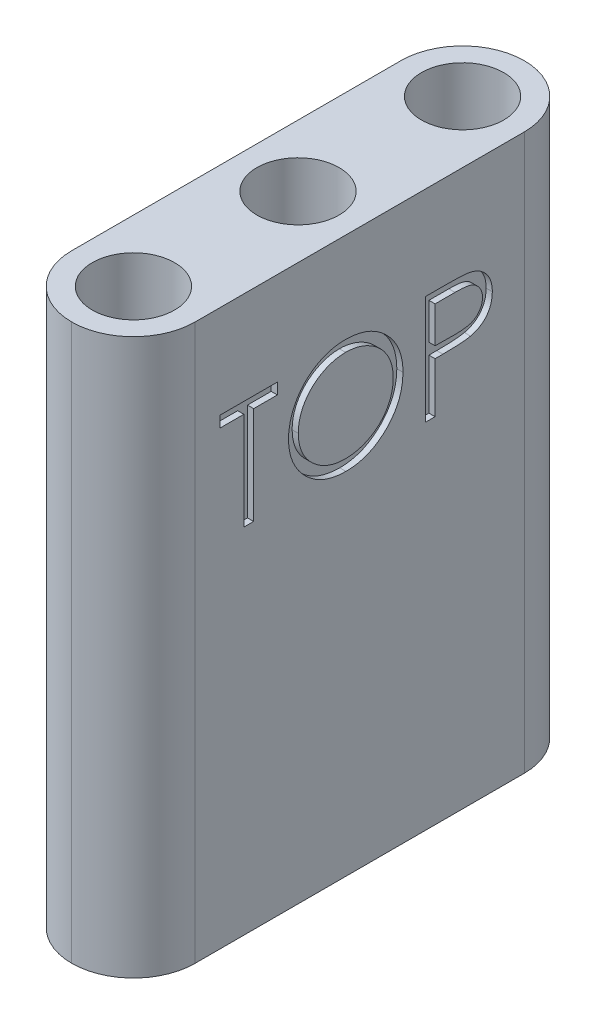
from build123d import *

# Parameters (mm, degrees)
SKETCH1_W           = 6
SKETCH1_H           = 22
SKETCH1_R           = 2
BOSS_EXTRUDE1_DEPTH = 27
FILLET1_R           = 3
CUT_EXTRUDE1_DEPTH  = 0.3


with BuildPart() as part:
    # Sketch1 → Boss-Extrude1 (new body)
    with BuildSketch(Plane(origin=(0, 0, 0), x_dir=(1, 0, 0), z_dir=(0, 1, 0))):
        with Locations((3, -11)):
            Rectangle(SKETCH1_W, SKETCH1_H)
        with Locations(Location((3, -11, 0), (0, 0, 270))):
            Circle(SKETCH1_R, mode=Mode.SUBTRACT)
        with Locations(Location((3, -19, 0), (0, 0, 270))):
            Circle(SKETCH1_R, mode=Mode.SUBTRACT)
        with Locations(Location((3, -3, 0), (0, 0, 90))):
            Circle(SKETCH1_R, mode=Mode.SUBTRACT)
    extrude(amount=BOSS_EXTRUDE1_DEPTH)

    # Fillet1
    fillet1_edges = [part.edges().sort_by_distance(p)[0] for p in [
        (0, 13.5, 0),
        (6, 13.5, 0),
        (0, 13.5, 22),
        (6, 13.5, 22),
    ]]
    fillet(fillet1_edges, radius=FILLET1_R - 0.0001)  # a hair under: the kernel refuses the full size

    # Sketch2 → Cut-Extrude1 (cut)
    # profile 1 of 3: a face of its own
    with BuildSketch(Plane(origin=(6, 0, 0), x_dir=(0, 0, -1), z_dir=(1, 0, 0))):
        Polygon((-17.784188034, 21.929487179), (-17.784188034, 22.472222222), (-15.00267094, 22.472222222), (-15.00267094, 21.929487179), (-16.155982906, 21.929487179), (-16.155982906, 17.180555556), (-16.630876068, 17.180555556), (-16.630876068, 21.929487179), align=None)
    # profile 2 of 3: a face of its own
    with BuildSketch(Plane(origin=(6, 0, 0), x_dir=(0, 0, -1), z_dir=(1, 0, 0))):
        with BuildLine():
            add(Edge.make_bspline(
                [(-11.712339744, 22.607905983), (-11.61435606, 22.605424222), (-11.42190802, 22.60054984), (-11.139068592, 22.563237386), (-10.869049817, 22.498686023), (-10.609652107, 22.412714609), (-10.363978202, 22.298030002), (-10.130178924, 22.15941079), (-9.908810555, 21.995404715), (-9.7028568, 21.807279575), (-9.514387363, 21.602592686), (-9.348341082, 21.384155846), (-9.2091819, 21.153289799), (-9.094903389, 20.910688305), (-9.005249538, 20.65690002), (-8.943383841, 20.390571945), (-8.903865448, 20.113429687), (-8.899245403, 19.924400975), (-8.896901709, 19.828508948)],
                knots=[0, 0, 0, 0, 1.065120563, 2.091984664, 3.0946048, 4.079830382, 5.057816894, 6.036188127, 7.030412546, 8.04752943, 9.064399622, 10.05169764, 11.02544977, 11.989514704, 12.962713494, 13.945757189, 14.957906945, 16, 16, 16, 16], degree=3))
            add(Edge.make_bspline(
                [(-8.896901709, 19.828508948), (-8.89924506, 19.733323285), (-8.903864075, 19.545701316), (-8.943428774, 19.270317775), (-9.005478857, 19.005597317), (-9.094070831, 18.751981866), (-9.20780459, 18.509203883), (-9.347890385, 18.277902179), (-9.512901501, 18.058000925), (-9.700690431, 17.851909158), (-9.905403911, 17.662924886), (-10.124978243, 17.49824992), (-10.354475286, 17.356547969), (-10.596848297, 17.243482177), (-10.848882877, 17.153112725), (-11.112834722, 17.09149863), (-11.387467012, 17.051755124), (-11.574748173, 17.047191415), (-11.669938568, 17.044871795)],
                knots=[0, 0, 0, 0, 1.043624062, 2.057103931, 3.04512605, 4.022047818, 4.998200453, 5.980619268, 6.982898556, 8.009068085, 9.034988726, 10.034168286, 11.015286542, 11.987931943, 12.962482838, 13.94673481, 14.956375938, 16, 16, 16, 16], degree=3))
            add(Edge.make_bspline(
                [(-11.669938568, 17.044871795), (-11.765830098, 17.04721432), (-11.95485783, 17.051832061), (-12.232348347, 17.091415852), (-12.498863508, 17.153315204), (-12.753641158, 17.241775899), (-12.996823373, 17.356101951), (-13.22888576, 17.49550619), (-13.448896851, 17.660919368), (-13.655032587, 17.848647403), (-13.843641494, 18.053013917), (-14.008075312, 18.271989517), (-14.1475109, 18.501278124), (-14.261453081, 18.741516047), (-14.351660061, 18.991541919), (-14.41320187, 19.253023545), (-14.453019321, 19.524470179), (-14.45760772, 19.709289799), (-14.459935897, 19.803068243)],
                knots=[0, 0, 0, 0, 1.053102029, 2.075944431, 3.073151272, 4.055350789, 5.033113405, 6.020478099, 7.024410459, 8.052272461, 9.079885166, 10.07527673, 11.055994387, 12.023226415, 12.992069828, 13.970394897, 14.97016774, 16, 16, 16, 16], degree=3))
            add(Edge.make_bspline(
                [(-14.459935897, 19.803068243), (-14.459127579, 19.866012873), (-14.457521141, 19.99110806), (-14.43818132, 20.176870658), (-14.410117796, 20.359645819), (-14.369898237, 20.5389138), (-14.31729655, 20.714235765), (-14.255229795, 20.886820847), (-14.179423124, 21.054920048), (-14.093727382, 21.2193297), (-13.998081553, 21.377486891), (-13.892436075, 21.526983403), (-13.780501649, 21.66907372), (-13.657790327, 21.800075738), (-13.528346416, 21.923800432), (-13.390070059, 22.038346445), (-13.243804999, 22.144746669), (-13.088921877, 22.240632184), (-12.929237104, 22.327353733), (-12.764625786, 22.401772484), (-12.597323588, 22.465644505), (-12.426546918, 22.517413372), (-12.252749275, 22.558283236), (-12.075551338, 22.586113402), (-11.895094277, 22.605502549), (-11.773520021, 22.607101391), (-11.712339744, 22.607905983)],
                knots=[0, 0, 0, 0, 1.037015668, 2.060948919, 3.074880161, 4.083647147, 5.086022904, 6.090072063, 7.104153813, 8.122640571, 9.144368836, 10.147691507, 11.138137339, 12.123020368, 13.103399296, 14.087645067, 15.080126199, 16.082011238, 17.087798457, 18.072939717, 19.057185487, 20.037253025, 21.01195951, 21.997135196, 22.992090687, 24, 24, 24, 24], degree=3))
        make_face()
        with BuildLine():
            add(Edge.make_bspline(
                [(-11.689019097, 22.06517094), (-11.73923646, 22.064558785), (-11.839191104, 22.063340326), (-11.987787962, 22.047290375), (-12.134430529, 22.024415424), (-12.279149088, 21.99178622), (-12.421338121, 21.947330092), (-12.562323, 21.896165862), (-12.700818093, 21.833843499), (-12.836366188, 21.763430005), (-12.967773504, 21.685492947), (-13.091768898, 21.599357061), (-13.208673371, 21.507042342), (-13.318200691, 21.40833335), (-13.420029249, 21.302727404), (-13.516163262, 21.191825507), (-13.602749415, 21.072457767), (-13.682102609, 20.94786108), (-13.75311351, 20.818197737), (-13.816258749, 20.684832826), (-13.867911476, 20.546678466), (-13.910036736, 20.40523349), (-13.94496145, 20.260721914), (-13.967086549, 20.112047476), (-13.983312855, 19.959957247), (-13.984461669, 19.857175158), (-13.985042735, 19.805188301)],
                knots=[0, 0, 0, 0, 1.008559885, 2.007477868, 2.99961109, 3.989939068, 4.984837346, 5.991145699, 7.001802488, 8.033829008, 9.059044045, 10.069351652, 11.065060232, 12.050310815, 13.029377138, 14.011219647, 14.996725999, 15.989392538, 16.977580475, 17.965360261, 18.951710183, 19.937753436, 20.929683414, 21.935841486, 22.955955122, 24, 24, 24, 24], degree=3))
            add(Edge.make_bspline(
                [(-13.985042735, 19.805188301), (-13.983115265, 19.728743039), (-13.979323336, 19.578351559), (-13.946125581, 19.357964008), (-13.894989977, 19.146163861), (-13.819610387, 18.944110021), (-13.725342196, 18.750065689), (-13.608884873, 18.565752245), (-13.470909827, 18.391119876), (-13.314180448, 18.227387743), (-13.142847308, 18.077942301), (-12.960915681, 17.94676429), (-12.770334631, 17.835774984), (-12.57060717, 17.74535541), (-12.362799581, 17.67370664), (-12.145572808, 17.624602043), (-11.920373899, 17.59228439), (-11.766869218, 17.589180818), (-11.689019097, 17.587606838)],
                knots=[0, 0, 0, 0, 1.032063989, 2.030389145, 3.003944642, 3.970395727, 4.937377036, 5.913328081, 6.909231446, 7.93887556, 8.970685674, 9.976071282, 10.964166581, 11.944589148, 12.933237628, 13.927779006, 14.949070134, 16, 16, 16, 16], degree=3))
            add(Edge.make_bspline(
                [(-11.689019097, 17.587606838), (-11.636692827, 17.588325755), (-11.532914117, 17.589751584), (-11.378555411, 17.604112679), (-11.226977567, 17.627141815), (-11.078393191, 17.660298877), (-10.932970917, 17.701796439), (-10.790103774, 17.751096218), (-10.651313502, 17.812602324), (-10.514849223, 17.880559346), (-10.384226334, 17.958029584), (-10.259531184, 18.041242025), (-10.143906786, 18.133420773), (-10.034461404, 18.23066318), (-9.932214779, 18.33492995), (-9.837858339, 18.446085523), (-9.751709806, 18.564831517), (-9.672386745, 18.689239214), (-9.601624669, 18.819257358), (-9.539970555, 18.953105799), (-9.487664522, 19.090454953), (-9.445439283, 19.231502924), (-9.412350549, 19.375981826), (-9.389551147, 19.524085111), (-9.373602912, 19.675516498), (-9.372400831, 19.777938756), (-9.371794872, 19.829568977)],
                knots=[0, 0, 0, 0, 1.047197238, 2.076906641, 3.100256066, 4.114471768, 5.12198147, 6.126382909, 7.136867548, 8.15857795, 9.17633901, 10.174870724, 11.156907918, 12.133735059, 13.104061851, 14.077631395, 15.04955518, 16.038496417, 17.029181396, 18.010275684, 18.986308667, 19.968651475, 20.955262928, 21.950658345, 22.966943676, 24, 24, 24, 24], degree=3))
            add(Edge.make_bspline(
                [(-9.371794872, 19.829568977), (-9.372401316, 19.880845989), (-9.373604311, 19.982563389), (-9.389543529, 20.132938674), (-9.412374637, 20.279976268), (-9.445277779, 20.423098922), (-9.48768694, 20.562343121), (-9.539979689, 20.697578084), (-9.601643178, 20.829307618), (-9.672412755, 20.957206138), (-9.751962869, 21.079934611), (-9.838888689, 21.197262068), (-9.934691061, 21.306985141), (-10.036632789, 21.411812595), (-10.147260199, 21.50950869), (-10.266072167, 21.600105835), (-10.391626299, 21.685790428), (-10.524563905, 21.763087408), (-10.661760121, 21.834470831), (-10.802539557, 21.895628896), (-10.945307363, 21.947596267), (-11.089700485, 21.991920726), (-11.236934274, 22.024287628), (-11.386013872, 22.04731099), (-11.536733025, 22.06333474), (-11.638095988, 22.064556931), (-11.689019097, 22.06517094)],
                knots=[0, 0, 0, 0, 1.02996197, 2.043119294, 3.035359645, 4.018872909, 4.991431989, 5.957985074, 6.929999688, 7.912076566, 8.892894881, 9.867085534, 10.843653904, 11.817741046, 12.803660682, 13.806313499, 14.818574707, 15.856120519, 16.894564902, 17.924820532, 18.937903209, 19.946497019, 20.957711757, 21.963978472, 22.977135795, 24, 24, 24, 24], degree=3))
        make_face(mode=Mode.SUBTRACT)
    # profile 3 of 3: a face of its own
    with BuildSketch(Plane(origin=(6, 0, 0), x_dir=(0, 0, -1), z_dir=(1, 0, 0))):
        with BuildLine():
            Line((-7.811431624, 22.472222222), (-6.773662861, 22.472222222))
            add(Edge.make_bspline(
                [(-6.773662861, 22.472222222), (-6.702284467, 22.47214376), (-6.565520294, 22.471993423), (-6.369403484, 22.467435414), (-6.19128639, 22.46134744), (-6.031553076, 22.452908149), (-5.88971207, 22.442934732), (-5.766405201, 22.42894653), (-5.660663252, 22.414341083), (-5.597304692, 22.399492052), (-5.568409455, 22.392720019)],
                knots=[0, 0, 0, 0, 1.415646017, 2.712440637, 3.8905458, 4.950247383, 5.884950622, 6.709939814, 7.411656543, 8, 8, 8, 8], degree=3))
            add(Edge.make_bspline(
                [(-5.568409455, 22.392720019), (-5.531831136, 22.382708261), (-5.459536421, 22.362920661), (-5.355364605, 22.323288007), (-5.256253434, 22.276294734), (-5.161862864, 22.222737111), (-5.07335281, 22.160317269), (-4.989402724, 22.09156549), (-4.910753468, 22.014894428), (-4.837847316, 21.931164024), (-4.77089292, 21.841779897), (-4.713244471, 21.745407716), (-4.664973544, 21.643669674), (-4.623572646, 21.536636537), (-4.593775339, 21.4234095), (-4.571328241, 21.304775304), (-4.557080614, 21.180746665), (-4.555716026, 21.095989485), (-4.555021368, 21.052842882)],
                knots=[0, 0, 0, 0, 0.999701418, 1.975846123, 2.934577507, 3.890451536, 4.834027766, 5.787354733, 6.749476667, 7.726910423, 8.712836071, 9.690891519, 10.682875813, 11.679750201, 12.712814741, 13.765529915, 14.8625177, 16, 16, 16, 16], degree=3))
            add(Edge.make_bspline(
                [(-4.555021368, 21.052842882), (-4.555658522, 21.009333624), (-4.556905157, 20.924204823), (-4.571867397, 20.799665012), (-4.592021378, 20.680650303), (-4.623010969, 20.567424586), (-4.66359907, 20.460660267), (-4.711212054, 20.358725785), (-4.768639535, 20.263355329), (-4.834626361, 20.174202663), (-4.908031747, 20.091184105), (-4.988545118, 20.014901261), (-5.075841429, 19.945800654), (-5.169643249, 19.883727372), (-5.270865044, 19.830120855), (-5.377971633, 19.782106834), (-5.491893984, 19.741782731), (-5.570728499, 19.720570614), (-5.61081063, 19.709785657)],
                knots=[0, 0, 0, 0, 1.121902311, 2.195077645, 3.232258892, 4.234102512, 5.217864754, 6.176164875, 7.132989551, 8.084763148, 9.034132444, 9.988522005, 10.94243251, 11.903244335, 12.886203696, 13.894208494, 14.929344452, 16, 16, 16, 16], degree=3))
            add(Edge.make_bspline(
                [(-5.61081063, 19.709785657), (-5.643962671, 19.702735674), (-5.716617296, 19.687285225), (-5.836273554, 19.670036725), (-5.975588602, 19.6553144), (-6.134372287, 19.644275776), (-6.312482084, 19.634825814), (-6.510014342, 19.627314529), (-6.727356816, 19.62318725), (-6.878957387, 19.622974385), (-6.958107973, 19.622863248)],
                knots=[0, 0, 0, 0, 0.601384939, 1.31797006, 2.144135048, 3.087295005, 4.142315834, 5.309527816, 6.595305764, 8, 8, 8, 8], degree=3))
            Line((-6.958107973, 19.622863248), (-7.336538462, 19.622863248))
            Line((-7.336538462, 19.622863248), (-7.336538462, 17.180555556))
            Line((-7.336538462, 17.180555556), (-7.811431624, 17.180555556))
            Line((-7.811431624, 17.180555556), (-7.811431624, 22.472222222))
        make_face()
        with BuildLine():
            Line((-7.336538462, 21.929487179), (-7.336538462, 20.165598291))
            Line((-7.336538462, 20.165598291), (-6.410072783, 20.153937967))
            add(Edge.make_bspline(
                [(-6.410072783, 20.153937967), (-6.364836705, 20.153914588), (-6.277509388, 20.153869454), (-6.151361765, 20.159894733), (-6.034326295, 20.1668503), (-5.926762473, 20.177034375), (-5.82862181, 20.191429609), (-5.739740665, 20.205961642), (-5.660808225, 20.226985225), (-5.568432051, 20.255292723), (-5.465496514, 20.303571797), (-5.353513435, 20.373648416), (-5.258610286, 20.46297282), (-5.176486195, 20.563405375), (-5.111314213, 20.67513382), (-5.063604558, 20.794678522), (-5.035572093, 20.920813485), (-5.031813205, 21.007125314), (-5.02991453, 21.050722823)],
                knots=[0, 0, 0, 0, 1.160613943, 2.240541288, 3.23993089, 4.169200891, 5.011653406, 5.7853311, 6.478053781, 7.106038997, 8.262395093, 9.384106736, 10.481365981, 11.59014053, 12.70357646, 13.786202915, 14.881775077, 16, 16, 16, 16], degree=3))
            add(Edge.make_bspline(
                [(-5.02991453, 21.050722823), (-5.031823531, 21.093265576), (-5.035618389, 21.177835302), (-5.063824278, 21.301779381), (-5.111221455, 21.420064315), (-5.176923687, 21.53039267), (-5.256663252, 21.630463838), (-5.349342021, 21.717394018), (-5.454741833, 21.787276831), (-5.552786182, 21.832381911), (-5.63987369, 21.859921673), (-5.715517248, 21.879190658), (-5.800925768, 21.894575205), (-5.896127053, 21.907032549), (-6.000383219, 21.917696711), (-6.114589957, 21.924932652), (-6.238314632, 21.929168187), (-6.324206805, 21.929378274), (-6.368731637, 21.929487179)],
                knots=[0, 0, 0, 0, 1.120700087, 2.227813068, 3.331159281, 4.466773991, 5.599788987, 6.693661531, 7.80175334, 8.91857717, 9.525282508, 10.207424825, 10.974604443, 11.810962634, 12.737642355, 13.736264703, 14.826523623, 16, 16, 16, 16], degree=3))
            Line((-6.368731637, 21.929487179), (-7.336538462, 21.929487179))
        make_face(mode=Mode.SUBTRACT)
    extrude(amount=-CUT_EXTRUDE1_DEPTH, mode=Mode.SUBTRACT)


solid = part.part
